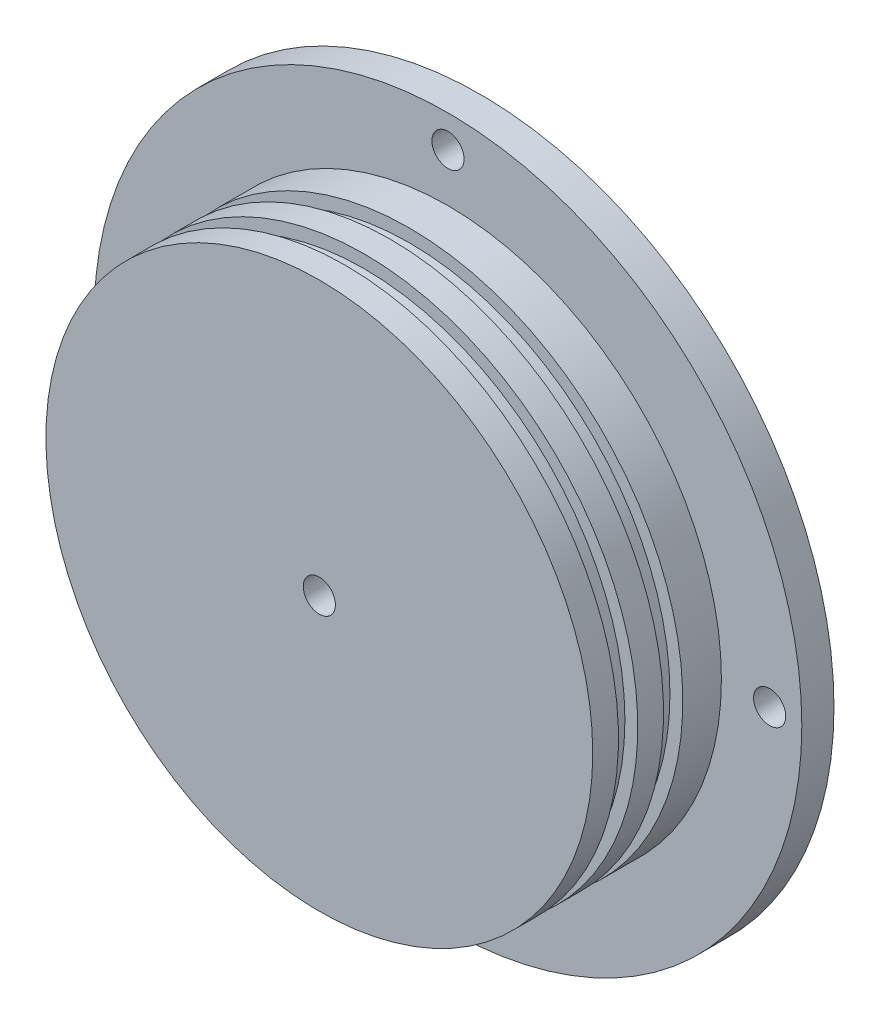
from build123d import *

# Parameters (mm, degrees)
SKETCH1_R           = 55
BOSS_EXTRUDE1_DEPTH = 5
SKETCH3_R           = 2.5
CUT_EXTRUDE1_DEPTH  = 78.942286341
CIRPATTERN1_COUNT   = 4
SKETCH2_R           = 42.5
BOSS_EXTRUDE2_DEPTH = 20
SKETCH4_W           = 3
SKETCH4_H           = 2
SKETCH5_R           = 2.5
CUT_EXTRUDE2_DEPTH  = 82.700673192
SKETCH6_R           = 20
CUT_EXTRUDE3_DEPTH  = 10


with BuildPart() as part:
    # Sketch1 → Boss-Extrude1 (new body)
    with BuildSketch(Plane.XY):
        Circle(SKETCH1_R)
    extrude(amount=BOSS_EXTRUDE1_DEPTH)

    # Sketch3 → Cut-Extrude1 (cut, through all)
    with BuildSketch(Plane(origin=(0, 0, 0), x_dir=(-1, 0, 0), z_dir=(0, 0, -1))):
        with Locations((0, 50)):
            Circle(SKETCH3_R)
    cut_extrude1 = extrude(amount=-CUT_EXTRUDE1_DEPTH, mode=Mode.SUBTRACT)

    # CirPattern1: Cut-Extrude1 ×4 about axis
    cirpattern1_axis = Axis((0, 0, 5), (0, 0, -1))
    for i in range(1, CIRPATTERN1_COUNT):
        add(cut_extrude1.rotate(cirpattern1_axis, i * 360 / CIRPATTERN1_COUNT), mode=Mode.SUBTRACT)

    # Sketch2 → Boss-Extrude2 (add)
    with BuildSketch(Plane.XY.offset(5)):
        Circle(SKETCH2_R)
    extrude(amount=BOSS_EXTRUDE2_DEPTH)

    # Sketch4 → Cut-Revolve1 (revolve, cut)
    with BuildSketch(Plane(origin=(0, 0, 0), x_dir=(0, 0, -1), z_dir=(1, 0, 0))):
        with Locations((-12.5, 41.5)):
            Rectangle(SKETCH4_W, SKETCH4_H)
        with Locations((-19.5, 41.5)):
            Rectangle(SKETCH4_W, SKETCH4_H)
    revolve(axis=Axis((0, 0, 0), (0, 0, 1)), mode=Mode.SUBTRACT)

    # Sketch5 → Cut-Extrude2 (cut, through all)
    with BuildSketch(Plane(origin=(0, 0, 0), x_dir=(-1, 0, 0), z_dir=(0, 0, -1))):
        Circle(SKETCH5_R)
    extrude(amount=-CUT_EXTRUDE2_DEPTH, mode=Mode.SUBTRACT)

    # Sketch6 → Cut-Extrude3 (cut)
    with BuildSketch(Plane(origin=(0, 0, 0), x_dir=(-1, 0, 0), z_dir=(0, 0, -1))):
        Circle(SKETCH6_R)
    extrude(amount=-CUT_EXTRUDE3_DEPTH, mode=Mode.SUBTRACT)


solid = part.part
